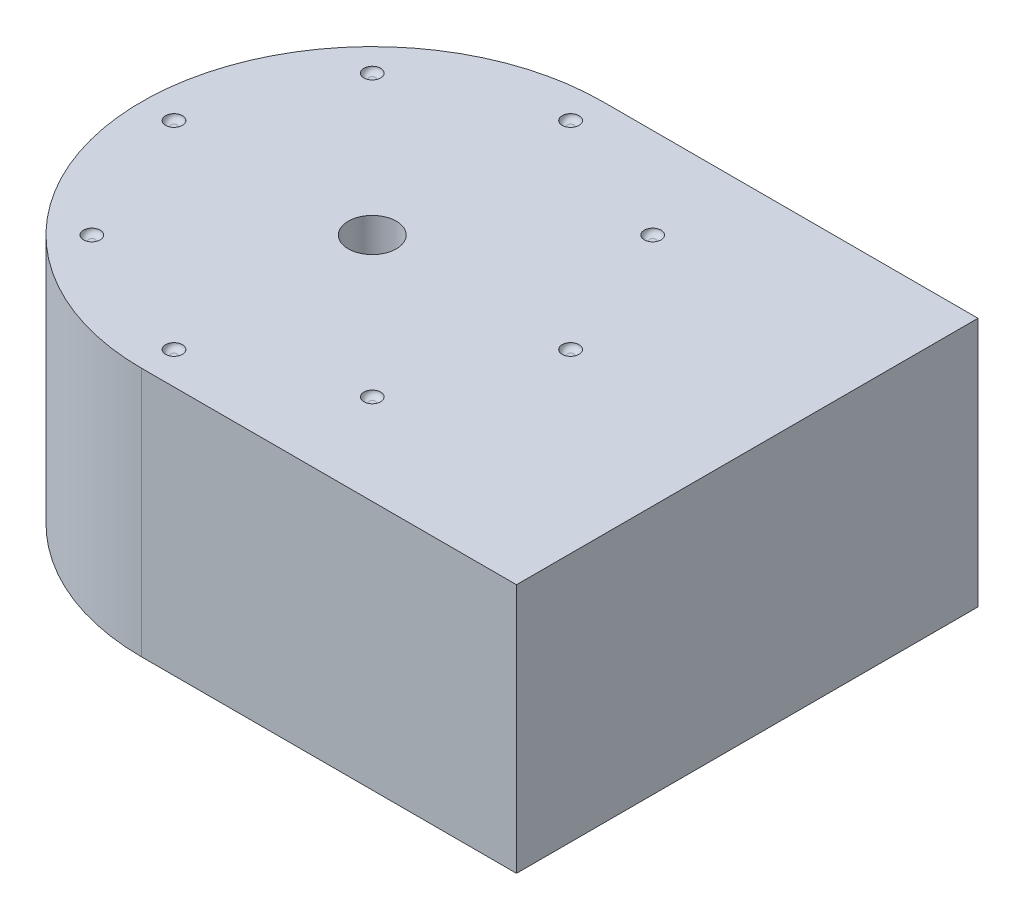
from build123d import *

# Parameters (mm, degrees)
SALIENTE_EXTRUIR1_DEPTH = 52
CROQUIS2_R              = 1.75
CORTAR_EXTRUIR1_DEPTH   = 1.1
REDONDEO1_R             = 1.1
MATRIZC3_COUNT          = 8
REDONDEO1_OF_MATRIZC3_R = 1.1
CROQUIS3_R              = 5
CORTAR_EXTRUIR2_DEPTH   = 10


with BuildPart() as part:
    # Croquis1 → Saliente-Extruir1 (new body)
    with BuildSketch(Plane(origin=(0, 0, 0), x_dir=(1, 0, 0), z_dir=(0, 1, 0))):
        with BuildLine():
            ThreePointArc((0, 48), (-48, 0), (0, -48))
            Line((0, -48), (0, 48))
        make_face()
        with BuildLine():
            Line((0, 48), (0, -48))
            ThreePointArc((0, -48), (33.941125497, -33.941125497), (48, 0))
            ThreePointArc((48, 0), (33.941125497, 33.941125497), (0, 48))
        make_face()
        with BuildLine():
            Line((0, -48), (78, -48))
            Line((78, -48), (78, 48))
            Line((78, 48), (0, 48))
            ThreePointArc((0, 48), (33.941125497, 33.941125497), (48, 0))
            ThreePointArc((48, 0), (33.941125497, -33.941125497), (0, -48))
        make_face()
    extrude(amount=SALIENTE_EXTRUIR1_DEPTH)

    # Croquis2 → Cortar-Extruir1 (cut)
    with BuildSketch(Plane(origin=(0, 52, 0), x_dir=(1, 0, 0), z_dir=(0, 1, 0))):
        with Locations(Location((0, 41.25, 0), (0, 0, 270))):
            Circle(CROQUIS2_R)
    cortar_extruir1 = extrude(amount=-CORTAR_EXTRUIR1_DEPTH, mode=Mode.SUBTRACT)

    # Redondeo1
    redondeo1_edges = [part.edges().sort_by_distance(p)[0] for p in [
        (0, 50.9, -43),
    ]]
    fillet(redondeo1_edges, radius=REDONDEO1_R - 0.0001)  # a hair under: the kernel refuses the full size

    # MatrizC3: Cortar-Extruir1 ×8 about axis
    matrizc3_axis = Axis((0, 0, 0), (0, 1, 0))
    for i in range(1, MATRIZC3_COUNT):
        add(cortar_extruir1.rotate(matrizc3_axis, i * 360 / MATRIZC3_COUNT), mode=Mode.SUBTRACT)

    # Redondeo1 of MatrizC3
    redondeo1_of_matrizc3_edges = [part.edges().sort_by_distance(p)[0] for p in [
        (-30.405591591, 50.9, -30.405591591),
        (-43, 50.9, 0),
        (-30.405591591, 50.9, 30.405591591),
        (0, 50.9, 43),
        (30.405591591, 50.9, 30.405591591),
        (43, 50.9, 0),
        (30.405591591, 50.9, -30.405591591),
    ]]
    fillet(redondeo1_of_matrizc3_edges, radius=REDONDEO1_OF_MATRIZC3_R - 0.0001)  # a hair under: the kernel refuses the full size

    # Croquis3 → Cortar-Extruir2 (cut)
    with BuildSketch(Plane(origin=(0, 52, 0), x_dir=(1, 0, 0), z_dir=(0, 1, 0))):
        with Locations(Location((0, 0, 0), (0, 0, 270))):
            Circle(CROQUIS3_R)
    extrude(amount=-CORTAR_EXTRUIR2_DEPTH, mode=Mode.SUBTRACT)


solid = part.part
